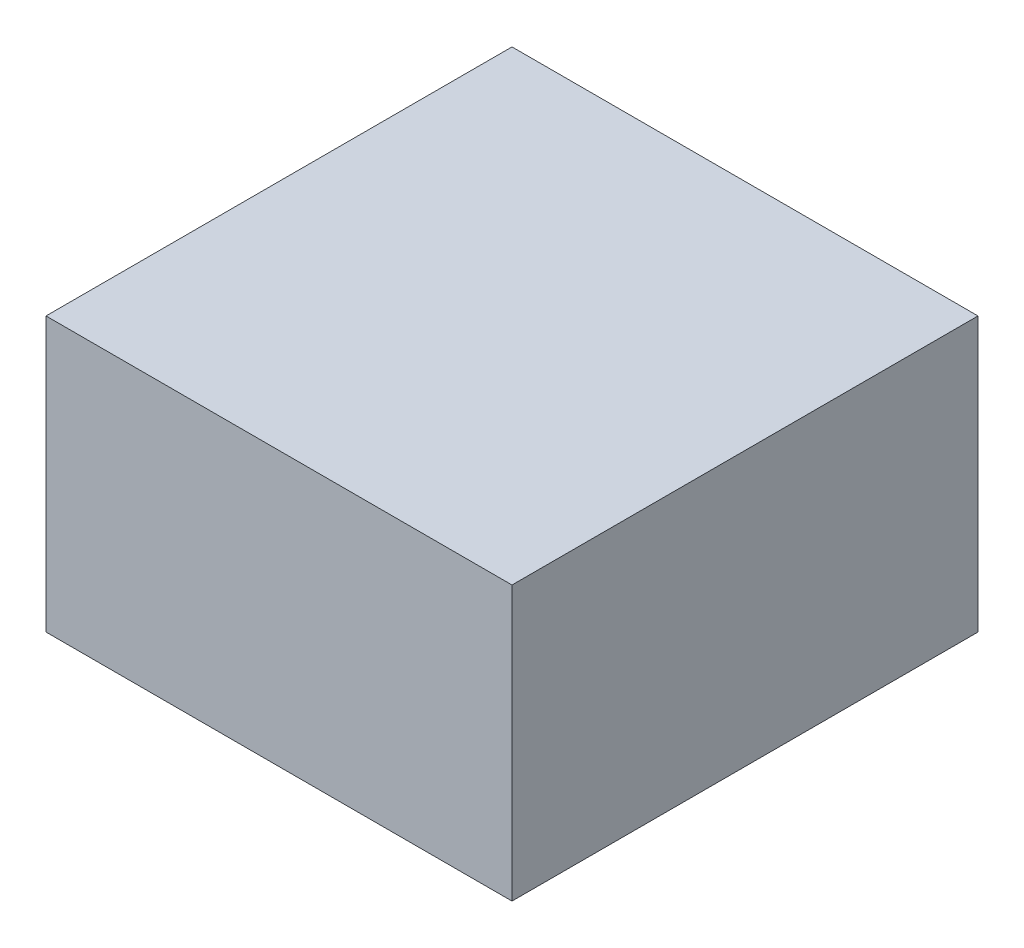
from build123d import *

# Parameters (mm, degrees)
SKETCH1_W           = 48
SKETCH1_H           = 48
BOSS_EXTRUDE1_DEPTH = 14.1


with BuildPart() as part:
    # Sketch1 → Boss-Extrude1 (new, symmetric)
    with BuildSketch(Plane(origin=(0, 0, 0), x_dir=(1, 0, 0), z_dir=(0, 1, 0))):
        Rectangle(SKETCH1_W, SKETCH1_H)
    extrude(amount=BOSS_EXTRUDE1_DEPTH, both=True)


solid = part.part
